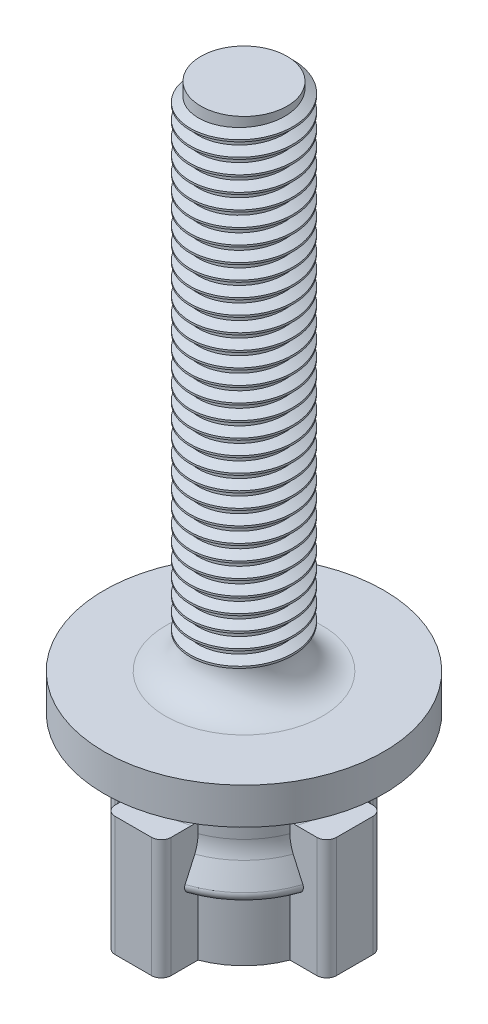
from build123d import *
from build123d.topology import SkipClean

# Parameters (mm, degrees)
SALIENTE_EXTRUIR1_REACH = 16.622
CORTAR_EXTRUIR1_START   = -0.15
CORTAR_EXTRUIR1_DEPTH   = 0.15
CROQUIS5_R              = 6
SALIENTE_EXTRUIR2_DEPTH = 3.55
CROQUIS6_R              = 11.5
SALIENTE_EXTRUIR3_DEPTH = 3
CROQUIS8_R              = 3.55
SALIENTE_EXTRUIR4_DEPTH = 42
REDONDEO5_R             = 1
ROSCA1_PITCH            = 1.25
CORTAR_EXTRUIR2_DEPTH   = 61.622440087
CROQUIS10_R             = 2
CORTAR_EXTRUIR3_DEPTH   = 54
REDONDEO8_R             = 2.9


with BuildPart() as part:
    # Croquis1 → Revolución1 (revolve)
    with BuildSketch(Plane.XY, mode=Mode.PRIVATE) as revoluci_n1_sk:
        with BuildLine():
            Line((0, 10), (6.5, 10))
            Line((6.5, 10), (6.5, 8.999997665))
            ThreePointArc((6.5, 8.999997665), (6.563051177, 8.328587834), (6.75, 7.680655161))
            Line((6.75, 7.680655161), (7.500350193, 5.912940884))
            ThreePointArc((7.500350193, 5.912940884), (7.453267502, 5.400543622), (7.000000015, 5.156994204))
            Line((7.000000015, 5.156994204), (6.849933772, 5.156994204))
            ThreePointArc((6.849933772, 5.156994204), (6.604864983, 5.056876732), (6.5, 4.813801529))
            Line((6.5, 4.813801529), (6.5, 0))
            Line((6.5, 0), (0, 0))
            Line((0, 0), (0, 10))
        make_face()
    revolve(revoluci_n1_sk.sketch.rotate(Axis((0, 0, 0), (0, 1, 0)), 90), axis=Axis((0, 0, 0), (0, 1, 0)))

    # Saliente-Extruir1: up to this face of the body (flat: up to its plane)
    saliente_extruir1_end = Plane(part.part.faces().sort_by_distance((0, 0, 0))[0])
    # Croquis2 → Saliente-Extruir1 (add, up to the picked face)
    with BuildSketch(Plane(origin=(0, 10, 0), x_dir=(1, 0, 0), z_dir=(0, 1, 0)), mode=Mode.PRIVATE) as saliente_extruir1_sk1:
        with BuildLine():
            Line((-1.5, 9.1), (1.5, 9.1))
            ThreePointArc((1.5, 9.1), (2.065685425, 8.865685425), (2.3, 8.3))
            Line((2.3, 8.3), (2.3, 6))
            Line((2.3, 6), (-2.3, 6))
            Line((-2.3, 6), (-2.3, 8.3))
            ThreePointArc((-2.3, 8.3), (-2.065685425, 8.865685425), (-1.5, 9.1))
        make_face()
    saliente_extruir1_tool1 = split(extrude(saliente_extruir1_sk1.sketch, amount=-SALIENTE_EXTRUIR1_REACH, mode=Mode.PRIVATE), bisect_by=saliente_extruir1_end, keep=Keep.BOTH, mode=Mode.PRIVATE)
    # Croquis2 → Saliente-Extruir1 (add, up to the picked face)
    with BuildSketch(Plane(origin=(0, 10, 0), x_dir=(1, 0, 0), z_dir=(0, 1, 0)), mode=Mode.PRIVATE) as saliente_extruir1_sk2:
        with BuildLine():
            Line((6, 2.3), (6, -2.3))
            Line((6, -2.3), (8.3, -2.3))
            ThreePointArc((8.3, -2.3), (8.865685425, -2.065685425), (9.1, -1.5))
            Line((9.1, -1.5), (9.1, 1.5))
            ThreePointArc((9.1, 1.5), (8.865685425, 2.065685425), (8.3, 2.3))
            Line((8.3, 2.3), (6, 2.3))
        make_face()
    saliente_extruir1_tool2 = split(extrude(saliente_extruir1_sk2.sketch, amount=-SALIENTE_EXTRUIR1_REACH, mode=Mode.PRIVATE), bisect_by=saliente_extruir1_end, keep=Keep.BOTH, mode=Mode.PRIVATE)
    # Croquis2 → Saliente-Extruir1 (add, up to the picked face)
    with BuildSketch(Plane(origin=(0, 10, 0), x_dir=(1, 0, 0), z_dir=(0, 1, 0)), mode=Mode.PRIVATE) as saliente_extruir1_sk3:
        with BuildLine():
            Line((2.3, -6), (-2.3, -6))
            Line((-2.3, -6), (-2.3, -8.3))
            ThreePointArc((-2.3, -8.3), (-2.065685425, -8.865685425), (-1.5, -9.1))
            Line((-1.5, -9.1), (1.5, -9.1))
            ThreePointArc((1.5, -9.1), (2.065685425, -8.865685425), (2.3, -8.3))
            Line((2.3, -8.3), (2.3, -6))
        make_face()
    saliente_extruir1_tool3 = split(extrude(saliente_extruir1_sk3.sketch, amount=-SALIENTE_EXTRUIR1_REACH, mode=Mode.PRIVATE), bisect_by=saliente_extruir1_end, keep=Keep.BOTH, mode=Mode.PRIVATE)
    # Croquis2 → Saliente-Extruir1 (add, up to the picked face)
    with BuildSketch(Plane(origin=(0, 10, 0), x_dir=(1, 0, 0), z_dir=(0, 1, 0)), mode=Mode.PRIVATE) as saliente_extruir1_sk4:
        with BuildLine():
            Line((-6, -2.3), (-6, 2.3))
            Line((-6, 2.3), (-8.3, 2.3))
            ThreePointArc((-8.3, 2.3), (-8.865685425, 2.065685425), (-9.1, 1.5))
            Line((-9.1, 1.5), (-9.1, -1.5))
            ThreePointArc((-9.1, -1.5), (-8.865685425, -2.065685425), (-8.3, -2.3))
            Line((-8.3, -2.3), (-6, -2.3))
        make_face()
    saliente_extruir1_tool4 = split(extrude(saliente_extruir1_sk4.sketch, amount=-SALIENTE_EXTRUIR1_REACH, mode=Mode.PRIVATE), bisect_by=saliente_extruir1_end, keep=Keep.BOTH, mode=Mode.PRIVATE)
    add(saliente_extruir1_tool1.solids().sort_by(Axis((0, 10, -7.523066), (0, -1, 0)))[0])
    add(saliente_extruir1_tool2.solids().sort_by(Axis((7.523066, 10, 0), (0, -1, 0)))[0])
    add(saliente_extruir1_tool3.solids().sort_by(Axis((0, 10, 7.523066), (0, -1, 0)))[0])
    add(saliente_extruir1_tool4.solids().sort_by(Axis((-7.523066, 10, 0), (0, -1, 0)))[0])

    # Croquis3 → Cortar-Extruir1 (cut)
    with BuildSketch(Plane(origin=(0, 10, 0), x_dir=(1, 0, 0), z_dir=(0, 1, 0)).offset(CORTAR_EXTRUIR1_START)):
        with BuildLine():
            Line((-2.3, -6.079473661), (-2.3, -8.3))
            ThreePointArc((-2.3, -8.3), (-2.065685425, -8.865685425), (-1.5, -9.1))
            Line((-1.5, -9.1), (1.5, -9.1))
            ThreePointArc((1.5, -9.1), (2.065685425, -8.865685425), (2.3, -8.3))
            Line((2.3, -8.3), (2.3, -6.079473661))
            ThreePointArc((2.3, -6.079473661), (4.596194078, -4.596194078), (6.079473661, -2.3))
            Line((6.079473661, -2.3), (8.3, -2.3))
            ThreePointArc((8.3, -2.3), (8.865685425, -2.065685425), (9.1, -1.5))
            Line((9.1, -1.5), (9.1, 1.5))
            ThreePointArc((9.1, 1.5), (8.865685425, 2.065685425), (8.3, 2.3))
            Line((8.3, 2.3), (6.079473661, 2.3))
            ThreePointArc((6.079473661, 2.3), (4.596194078, 4.596194078), (2.3, 6.079473661))
            Line((2.3, 6.079473661), (2.3, 8.3))
            ThreePointArc((2.3, 8.3), (2.065685425, 8.865685425), (1.5, 9.1))
            Line((1.5, 9.1), (-1.5, 9.1))
            ThreePointArc((-1.5, 9.1), (-2.065685425, 8.865685425), (-2.3, 8.3))
            Line((-2.3, 8.3), (-2.3, 6.079473661))
            ThreePointArc((-2.3, 6.079473661), (-4.596194078, 4.596194078), (-6.079473661, 2.3))
            Line((-6.079473661, 2.3), (-8.3, 2.3))
            ThreePointArc((-8.3, 2.3), (-8.865685425, 2.065685425), (-9.1, 1.5))
            Line((-9.1, 1.5), (-9.1, -1.5))
            ThreePointArc((-9.1, -1.5), (-8.865685425, -2.065685425), (-8.3, -2.3))
            Line((-8.3, -2.3), (-6.079473661, -2.3))
            ThreePointArc((-6.079473661, -2.3), (-4.596194078, -4.596194078), (-2.3, -6.079473661))
        make_face()
    extrude(amount=CORTAR_EXTRUIR1_DEPTH, mode=Mode.SUBTRACT)

    # Croquis5 → Saliente-Extruir2 (add)
    with BuildSketch(Plane(origin=(0, 9.85, 0), x_dir=(1, 0, 0), z_dir=(0, 1, 0))):
        with Locations(Location((0, 0, 0), (0, 0, 270))):
            Circle(CROQUIS5_R)
    extrude(amount=SALIENTE_EXTRUIR2_DEPTH)

    # Croquis6 → Saliente-Extruir3 (add)
    with BuildSketch(Plane(origin=(0, 13.4, 0), x_dir=(1, 0, 0), z_dir=(0, 1, 0))):
        with Locations(Location((0, 0, 0), (0, 0, 270))):
            Circle(CROQUIS6_R)
    extrude(amount=SALIENTE_EXTRUIR3_DEPTH)

    # Croquis8 → Saliente-Extruir4 (add)
    with BuildSketch(Plane(origin=(0, 16.4, 0), x_dir=(1, 0, 0), z_dir=(0, 1, 0))):
        with Locations(Location((0, 0, 0), (0, 0, 90))):
            Circle(CROQUIS8_R)
    extrude(amount=SALIENTE_EXTRUIR4_DEPTH)

    # Redondeo5
    # the kernel refuses this fillet: 1 mm, written as the material it adds along each edge
    with BuildSketch(Plane(origin=(0, 9.85, 0), x_dir=(0, 0, 1), z_dir=(-1, 0, 0))) as redondeo5_piece_1_section:
        with BuildLine():
            CenterArc((6 + REDONDEO5_R, REDONDEO5_R), REDONDEO5_R, 180, 90)
            Line((6 + REDONDEO5_R, 0), (6, 0))
            Line((6, 0), (6, REDONDEO5_R))
        make_face()
    redondeo5_piece_1 = revolve(axis=Axis((0, 9.85, 0), (0, 1, 0)), mode=Mode.PRIVATE)
    redondeo5_piece_1 = split(redondeo5_piece_1, bisect_by=Plane(origin=(-2.3, 9.85, 0), z_dir=(1, 0, 0)), keep=Keep.TOP, mode=Mode.PRIVATE)
    redondeo5_piece_1 = split(redondeo5_piece_1, bisect_by=Plane(origin=(2.3, 9.85, 0), z_dir=(-1, 0, 0)), keep=Keep.TOP, mode=Mode.PRIVATE)
    add(redondeo5_piece_1)
    with BuildSketch(Plane(origin=(0, 9.85, 0), x_dir=(0, 0, 1), z_dir=(-1, 0, 0))) as redondeo5_piece_2_section:
        with BuildLine():
            CenterArc((6 + REDONDEO5_R, REDONDEO5_R), REDONDEO5_R, 180, 90)
            Line((6 + REDONDEO5_R, 0), (6, 0))
            Line((6, 0), (6, REDONDEO5_R))
        make_face()
    redondeo5_piece_2 = revolve(axis=Axis((0, 9.85, 0), (0, 1, 0)), mode=Mode.PRIVATE)
    redondeo5_piece_2 = redondeo5_piece_2 & Plane(origin=(0, 9.85, 0), x_dir=(0, 0, -1), z_dir=(0, -1, 0)) * Cylinder(6.5, 28, mode=Mode.PRIVATE)
    add(redondeo5_piece_2)
    with BuildSketch(Plane(origin=(0, 9.85, 0), x_dir=(0, 0, 1), z_dir=(-1, 0, 0))) as redondeo5_piece_3_section:
        with BuildLine():
            CenterArc((6 + REDONDEO5_R, REDONDEO5_R), REDONDEO5_R, 180, 90)
            Line((6 + REDONDEO5_R, 0), (6, 0))
            Line((6, 0), (6, REDONDEO5_R))
        make_face()
    redondeo5_piece_3 = revolve(axis=Axis((0, 9.85, 0), (0, 1, 0)), mode=Mode.PRIVATE)
    redondeo5_piece_3 = split(redondeo5_piece_3, bisect_by=Plane(origin=(0, 9.85, 2.3), z_dir=(0, 0, -1)), keep=Keep.TOP, mode=Mode.PRIVATE)
    redondeo5_piece_3 = split(redondeo5_piece_3, bisect_by=Plane(origin=(0, 9.85, -2.3), z_dir=(0, 0, 1)), keep=Keep.TOP, mode=Mode.PRIVATE)
    add(redondeo5_piece_3)
    with BuildSketch(Plane(origin=(0, 13.4, 0), x_dir=(0, 0, 1), z_dir=(-1, 0, 0))) as redondeo5_piece_4:
        with BuildLine():
            CenterArc((6 + REDONDEO5_R, -REDONDEO5_R), REDONDEO5_R, 90, 90)
            Line((6, -REDONDEO5_R), (6, 0))
            Line((6, 0), (6 + REDONDEO5_R, 0))
        make_face()
    revolve(axis=Axis((0, 13.4, 0), (0, 1, 0)))

    # Rosca1: arcs per turn and ends read off the stored shape
    # Rosca1: the profile of Perfil de rosca1 profile screwed along a right-hand helix through 31.2 turns, 8 arcs to a turn; built about Z, then put on its axis
    rosca1_z = Axis((0, 0, 0), (0, 0, 1))
    rosca1_corners = [(3.5497, 0, -0.000173205), (4.226582344, 0, 0.390624998), (4.226582344, 0, 0.546874998), (3.5497, 0, 0.937673202)]
    with BuildLine(mode=Mode.PRIVATE) as rosca1_profile:
        Line(rosca1_corners[0], rosca1_corners[1])
        Line(rosca1_corners[1], rosca1_corners[2])
        Line(rosca1_corners[2], rosca1_corners[3])
        Line(rosca1_corners[3], rosca1_corners[0])
    rosca1_cap = Face(rosca1_profile.wire())
    rosca1_turn_angles = [0, 22.5, 45, 67.5, 90, 112.5, 135, 157.5, 180, 202.5, 225, 247.5, 270, 292.5, 315, 337.5, 360]
    rosca1_turn_weights = [1, 0.9238795325112867, 1, 0.9238795325112867, 1, 0.9238795325112867, 1, 0.9238795325112867, 1, 0.9238795325112867, 1, 0.9238795325112867, 1, 0.9238795325112867, 1, 0.9238795325112867, 1]
    rosca1_turn_rails = [Edge.make_bspline([Vector(p[0], p[1], 0).rotate(rosca1_z, rosca1_turn_angles[k]) / rosca1_turn_weights[k] + Vector(0, 0, p[2] + ROSCA1_PITCH * rosca1_turn_angles[k] / 360) for k in range(17)], [0, 0, 0, 1, 1, 2, 2, 3, 3, 4, 4, 5, 5, 6, 6, 7, 7, 8, 8, 8], 2, rosca1_turn_weights) for p in rosca1_corners]
    rosca1_turn_sides = [Face.make_surface_from_curves(rosca1_turn_rails[p[0]], rosca1_turn_rails[p[1]]) for p in [(0, 1), (1, 2), (2, 3), (3, 0)]]
    rosca1_last_angles = [11160, 11182.5, 11205, 11218.5, 11232]
    rosca1_last_weights = [1, 0.9238795325112867, 1, 0.9723699203976766, 1]
    rosca1_last_rails = [Edge.make_bspline([Vector(p[0], p[1], 0).rotate(rosca1_z, rosca1_last_angles[k]) / rosca1_last_weights[k] + Vector(0, 0, p[2] + ROSCA1_PITCH * rosca1_last_angles[k] / 360) for k in range(5)], [0, 0, 0, 1, 1, 2, 2, 2], 2, rosca1_last_weights) for p in rosca1_corners]
    rosca1_last_sides = [Face.make_surface_from_curves(rosca1_last_rails[p[0]], rosca1_last_rails[p[1]]) for p in [(0, 1), (1, 2), (2, 3), (3, 0)]]
    rosca1 = Plane(origin=(0, 58.4, 0), x_dir=(-1, 0, 0), z_dir=(0, -1, 0)) * Solid(Shell([*[p.moved(Location((0, 0, ROSCA1_PITCH * i))) for i in range(31) for p in rosca1_turn_sides], *rosca1_last_sides, rosca1_cap, rosca1_cap.rotate(rosca1_z, 11232).moved(Location((0, 0, ROSCA1_PITCH * 11232 / 360)))]))
    add(rosca1)

    # Croquis9 → Cortar-Extruir2 (cut, through all)
    with SkipClean():  # the faces are left unmerged after this step: merging them gives an invalid solid
        with BuildSketch(Plane.XY):
            Polygon((-4.226582344, 58.009375002), (-3.55, 58.4), (-3.55, 55.322845005), (-4.226582344, 55.322845005), align=None)
        extrude(amount=-CORTAR_EXTRUIR2_DEPTH, mode=Mode.SUBTRACT)

    # Croquis10 → Cortar-Extruir3 (cut)
    with SkipClean():  # the faces are left unmerged after this step: merging them gives an invalid solid
        with BuildSketch(Plane.XZ):
            with Locations(Location((0, 0, 0), (0, 0, 270))):
                Circle(CROQUIS10_R)
        extrude(amount=-CORTAR_EXTRUIR3_DEPTH, mode=Mode.SUBTRACT)

    # Redondeo8
    # the kernel refuses this fillet: 2.9 mm, written as the material it adds along each edge
    with BuildSketch(Plane(origin=(0, 16.4, 0), x_dir=(0, 0, -1), z_dir=(1, 0, 0))) as redondeo8_piece_1:
        with BuildLine():
            CenterArc((3.55 + REDONDEO8_R, REDONDEO8_R), REDONDEO8_R, 180, 90)
            Line((3.55, REDONDEO8_R), (3.55, 0))
            Line((3.55, 0), (3.55 + REDONDEO8_R, 0))
        make_face()
    revolve(axis=Axis((0, 16.4, 0), (0, 1, 0)))


solid = part.part
